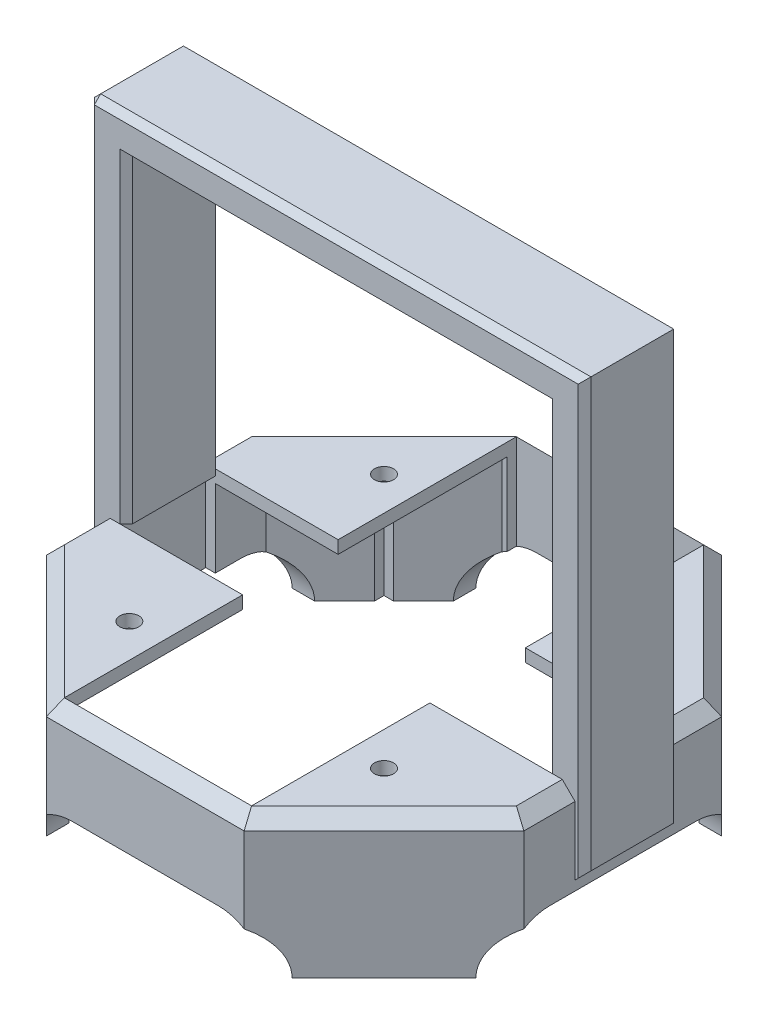
from build123d import *

# Parameters (mm, degrees)
BOSS_EXTRUDE1_DEPTH            = 50
BOSS_EXTRUDE4_DEPTH            = 55
CUT_EXTRUDE1_REACH             = 103.972
CUT_EXTRUDE2_REACH             = 103.972
CUT_EXTRUDE2_DIRECTION_2_REACH = 103.972
CHAMFER5_SIZE                  = 3
SKETCH11_R                     = 10
CUT_EXTRUDE5_DEPTH             = 78
CHAMFER7_SIZE                  = 2
BOSS_EXTRUDE10_DEPTH           = 50
BOSS_EXTRUDE10_DEPTH_BACK      = 14.2
SKETCH18_W                     = 6
SKETCH18_H                     = 15
BOSS_EXTRUDE10_2_DEPTH         = 50
BOSS_EXTRUDE10_2_DEPTH_BACK    = 14.2
SKETCH20_W                     = 78
SKETCH20_H                     = 15
BOSS_EXTRUDE11_DEPTH           = 6
CHAMFER8_SIZE                  = 3
CHAMFER9_SIZE                  = 1
CUT_EXTRUDE6_START             = -78
SKETCH21_W                     = 35
SKETCH21_H                     = 20
CUT_EXTRUDE6_DEPTH             = 78
CUT_EXTRUDE7_REACH             = 139.263
SKETCH22_W                     = 32.308657866
SKETCH22_H                     = 14
SKETCH25_R                     = 1.5
BOSS_EXTRUDE12_DEPTH           = 5
SKETCH26_W                     = 29.409162928
SKETCH26_H                     = 71
CUT_EXTRUDE9_DEPTH             = 15
SKETCH27_W                     = 71
SKETCH27_H                     = 15
CUT_EXTRUDE10_DEPTH            = 15
CHAMFER10_SIZE                 = 8
SKETCH28_W                     = 10.5
SKETCH28_H                     = 59
CUT_EXTRUDE11_DEPTH            = 2
SKETCH29_R                     = 3
CUT_EXTRUDE12_DEPTH            = 1
SKETCH30_W                     = 99
SKETCH30_H                     = 78
CUT_EXTRUDE13_DEPTH            = 83
CUT_EXTRUDE14_REACH            = 79.867
SKETCH31_R                     = 1.5
SKETCH32_W                     = 51
SKETCH32_H                     = 51
CUT_EXTRUDE15_DEPTH            = 20
CUT_EXTRUDE16_DEPTH            = 20


with BuildPart() as part:
    # Sketch1 → Boss-Extrude1 (new body)
    with BuildSketch(Plane(origin=(0, 0, 0), x_dir=(1, 0, 0), z_dir=(0, 1, 0))):
        Polygon((15.533008589, 37.5), (-15.533008589, 37.5), (-37.5, 15.533008589), (-37.5, -15.533008589), (-15.533008589, -37.5), (15.533008589, -37.5), (37.5, -15.533008589), (37.5, 15.533008589), align=None)
    extrude(amount=BOSS_EXTRUDE1_DEPTH)

    # Sketch7 → Boss-Extrude4 (add)
    with BuildSketch(Plane.XZ):
        Polygon((39, 16.154328933), (16.154328933, 39), (-16.154328933, 39), (-39, 16.154328933), (-39, -16.154328933), (-16.154328933, -39), (16.154328933, -39), (39, -16.154328933), align=None)
    extrude(amount=BOSS_EXTRUDE4_DEPTH)

    # Cut-Extrude1: up to this face of the body (flat: up to its plane)
    cut_extrude1_end = Plane(part.part.faces().sort_by_distance((0, 25, -37.5))[0])
    # Sketch3 → Cut-Extrude1 (cut, up to the picked face)
    with BuildSketch(Plane.XY.offset(37.5), mode=Mode.PRIVATE) as cut_extrude1_sk1:
        with BuildLine():
            Line((-11.5, 35.8), (11.5, 35.8))
            ThreePointArc((11.5, 35.8), (19.3, 28), (11.5, 20.2))
            Line((11.5, 20.2), (-11.5, 20.2))
            ThreePointArc((-11.5, 20.2), (-19.3, 28), (-11.5, 35.8))
        make_face()
    cut_extrude1_tool1 = split(extrude(cut_extrude1_sk1.sketch, amount=-CUT_EXTRUDE1_REACH, mode=Mode.PRIVATE), bisect_by=cut_extrude1_end, keep=Keep.BOTH, mode=Mode.PRIVATE)
    add(cut_extrude1_tool1.solids().sort_by(Axis((0, 28, 37.5), (0, 0, -1)))[0], mode=Mode.SUBTRACT)

    # Cut-Extrude2: up to this face of the body (flat: up to its plane)
    cut_extrude2_end = Plane(part.part.faces().sort_by_distance((39, -27.5, 0))[0])
    # Sketch4 → Cut-Extrude2 (cut, up to the picked face)
    with BuildSketch(Plane.ZY.offset(37.5), mode=Mode.PRIVATE) as cut_extrude2_sk1:
        with BuildLine():
            Line((-11.5, 35.8), (11.5, 35.8))
            ThreePointArc((11.5, 35.8), (19.3, 28), (11.5, 20.2))
            Line((11.5, 20.2), (-11.5, 20.2))
            ThreePointArc((-11.5, 20.2), (-19.3, 28), (-11.5, 35.8))
        make_face()
    cut_extrude2_tool1 = split(extrude(cut_extrude2_sk1.sketch, amount=-CUT_EXTRUDE2_REACH, mode=Mode.PRIVATE), bisect_by=cut_extrude2_end, keep=Keep.BOTH, mode=Mode.PRIVATE)
    add(cut_extrude2_tool1.solids().sort_by(Axis((-37.5, 28, 0), (1, 0, 0)))[0], mode=Mode.SUBTRACT)

    # Cut-Extrude2 direction 2: up to this face of the body (flat: up to its plane)
    cut_extrude2_direction_2_end = Plane(part.part.faces().sort_by_distance((-39, -27.5, 0))[0])
    # Sketch4 → Cut-Extrude2 direction 2 (cut, up to the picked face)
    with BuildSketch(Plane.ZY.offset(37.5), mode=Mode.PRIVATE) as cut_extrude2_direction_2_sk1:
        with BuildLine():
            Line((-11.5, 35.8), (11.5, 35.8))
            ThreePointArc((11.5, 35.8), (19.3, 28), (11.5, 20.2))
            Line((11.5, 20.2), (-11.5, 20.2))
            ThreePointArc((-11.5, 20.2), (-19.3, 28), (-11.5, 35.8))
        make_face()
    cut_extrude2_direction_2_tool1 = split(extrude(cut_extrude2_direction_2_sk1.sketch, amount=CUT_EXTRUDE2_DIRECTION_2_REACH, mode=Mode.PRIVATE), bisect_by=cut_extrude2_direction_2_end, keep=Keep.BOTH, mode=Mode.PRIVATE)
    add(cut_extrude2_direction_2_tool1.solids().sort_by(Axis((-37.5, 28, 0), (-1, 0, 0)))[0], mode=Mode.SUBTRACT)

    # Chamfer5
    # the kernel refuses this chamfer: 3 mm, written as the material it takes off along each edge
    with BuildSketch(Plane(origin=(-39, 0, 23.869377896), x_dir=(0.9996219169112968, 0.02749587661058636, 0), z_dir=(0, 0, -1))) as chamfer5_piece_1_section:
        Polygon((CHAMFER5_SIZE * 0.999621916911, CHAMFER5_SIZE * 0.0274958766106), (-CHAMFER5_SIZE * 0.0274958766106, CHAMFER5_SIZE * 0.999621916911), (0, 0), align=None)
    chamfer5_piece_1 = extrude(amount=47.738755793, mode=Mode.PRIVATE)
    chamfer5_piece_1 = split(chamfer5_piece_1, bisect_by=Plane(origin=(-35.021082904, -0.446756955, 18.011925685), z_dir=(-0.7071067811865472, 0, 0.7071067811865478)), keep=Keep.TOP, mode=Mode.PRIVATE)
    chamfer5_piece_1 = split(chamfer5_piece_1, bisect_by=Plane(origin=(-37.5, -0.446756955, 19.964409756), z_dir=(1, 0, 0)), keep=Keep.TOP, mode=Mode.PRIVATE)
    add(chamfer5_piece_1, mode=Mode.SUBTRACT)
    with BuildSketch(Plane(origin=(-39, 0, 23.869377896), x_dir=(0.9996219169112968, 0.02749587661058636, 0), z_dir=(0, 0, -1))) as chamfer5_piece_2_section:
        Polygon((CHAMFER5_SIZE * 0.999621916911, CHAMFER5_SIZE * 0.0274958766106), (-CHAMFER5_SIZE * 0.0274958766106, CHAMFER5_SIZE * 0.999621916911), (0, 0), align=None)
    chamfer5_piece_2 = extrude(amount=47.738755793, mode=Mode.PRIVATE)
    chamfer5_piece_2 = split(chamfer5_piece_2, bisect_by=Plane(origin=(-36.088598383, -1.192457028, 16.944410206), z_dir=(-0.7071067811865472, 0, 0.7071067811865478)), keep=Keep.TOP, mode=Mode.PRIVATE)
    chamfer5_piece_2 = split(chamfer5_piece_2, bisect_by=Plane(origin=(-37.5, -1.192457028, 19.252732769), z_dir=(-1, 0, 0)), keep=Keep.TOP, mode=Mode.PRIVATE)
    add(chamfer5_piece_2, mode=Mode.SUBTRACT)
    with BuildSketch(Plane(origin=(-39, 0, 23.869377896), x_dir=(0.9996219169112968, 0.02749587661058636, 0), z_dir=(0, 0, -1))) as chamfer5_piece_3_section:
        Polygon((CHAMFER5_SIZE * 0.999621916911, CHAMFER5_SIZE * 0.0274958766106), (-CHAMFER5_SIZE * 0.0274958766106, CHAMFER5_SIZE * 0.999621916911), (0, 0), align=None)
    chamfer5_piece_3 = extrude(amount=47.738755793, mode=Mode.PRIVATE)
    chamfer5_piece_3 = split(chamfer5_piece_3, bisect_by=Plane(origin=(-45.697358096, -1.172502344, 7.335650493), z_dir=(0.7071067811865472, 0, -0.7071067811865478)), keep=Keep.TOP, mode=Mode.PRIVATE)
    chamfer5_piece_3 = split(chamfer5_piece_3, bisect_by=Plane(origin=(-37.5, -1.172502344, 0), z_dir=(-1, 0, 0)), keep=Keep.TOP, mode=Mode.PRIVATE)
    chamfer5_piece_3 = split(chamfer5_piece_3, bisect_by=Plane(origin=(-45.697358096, -1.172502344, -7.335650493), z_dir=(0.7071067811865479, 0, 0.7071067811865472)), keep=Keep.TOP, mode=Mode.PRIVATE)
    add(chamfer5_piece_3, mode=Mode.SUBTRACT)
    with BuildSketch(Plane(origin=(-39, 0, 23.869377896), x_dir=(0.9996219169112968, 0.02749587661058636, 0), z_dir=(0, 0, -1))) as chamfer5_piece_4_section:
        Polygon((CHAMFER5_SIZE * 0.999621916911, CHAMFER5_SIZE * 0.0274958766106), (-CHAMFER5_SIZE * 0.0274958766106, CHAMFER5_SIZE * 0.999621916911), (0, 0), align=None)
    chamfer5_piece_4 = extrude(amount=47.738755793, mode=Mode.PRIVATE)
    chamfer5_piece_4 = split(chamfer5_piece_4, bisect_by=Plane(origin=(-37.5, -0.446756955, -19.964409756), z_dir=(1, 0, 0)), keep=Keep.TOP, mode=Mode.PRIVATE)
    chamfer5_piece_4 = split(chamfer5_piece_4, bisect_by=Plane(origin=(-35.021082904, -0.446756955, -18.011925685), z_dir=(-0.7071067811865479, 0, -0.7071067811865472)), keep=Keep.TOP, mode=Mode.PRIVATE)
    add(chamfer5_piece_4, mode=Mode.SUBTRACT)
    with BuildSketch(Plane(origin=(-39, 0, 23.869377896), x_dir=(0.9996219169112968, 0.02749587661058636, 0), z_dir=(0, 0, -1))) as chamfer5_piece_5_section:
        Polygon((CHAMFER5_SIZE * 0.999621916911, CHAMFER5_SIZE * 0.0274958766106), (-CHAMFER5_SIZE * 0.0274958766106, CHAMFER5_SIZE * 0.999621916911), (0, 0), align=None)
    chamfer5_piece_5 = extrude(amount=47.738755793, mode=Mode.PRIVATE)
    chamfer5_piece_5 = split(chamfer5_piece_5, bisect_by=Plane(origin=(-37.5, -1.192457028, -19.252732769), z_dir=(-1, 0, 0)), keep=Keep.TOP, mode=Mode.PRIVATE)
    chamfer5_piece_5 = split(chamfer5_piece_5, bisect_by=Plane(origin=(-36.088598383, -1.192457028, -16.944410206), z_dir=(-0.7071067811865479, 0, -0.7071067811865472)), keep=Keep.TOP, mode=Mode.PRIVATE)
    add(chamfer5_piece_5, mode=Mode.SUBTRACT)
    with BuildSketch(Plane(origin=(-44.45536344, 0, -10.698965493), x_dir=(0.7068394360706735, 0.027495876610586327, 0.7068394360706735), z_dir=(0.7071067811865476, 0, -0.7071067811865476))) as chamfer5_piece_6_section:
        Polygon((CHAMFER5_SIZE * 0.999621916911, CHAMFER5_SIZE * 0.0274958766106), (-CHAMFER5_SIZE * 0.0274958766106, CHAMFER5_SIZE * 0.999621916911), (0, 0), align=None)
    chamfer5_piece_6 = extrude(amount=47.738755793, mode=Mode.PRIVATE)
    chamfer5_piece_6 = split(chamfer5_piece_6, bisect_by=Plane(origin=(-37.5, -0.446756955, -12.027290412), z_dir=(-1, 0, 0)), keep=Keep.TOP, mode=Mode.PRIVATE)
    chamfer5_piece_6 = split(chamfer5_piece_6, bisect_by=Plane(origin=(-40.633473815, -0.446756955, -12.399534774), z_dir=(0.7071067811865479, 0, 0.7071067811865472)), keep=Keep.TOP, mode=Mode.PRIVATE)
    add(chamfer5_piece_6, mode=Mode.SUBTRACT)
    with BuildSketch(Plane(origin=(-44.45536344, 0, -10.698965493), x_dir=(0.7068394360706735, 0.027495876610586327, 0.7068394360706735), z_dir=(0.7071067811865476, 0, -0.7071067811865476))) as chamfer5_piece_7_section:
        Polygon((CHAMFER5_SIZE * 0.999621916911, CHAMFER5_SIZE * 0.0274958766106), (-CHAMFER5_SIZE * 0.0274958766106, CHAMFER5_SIZE * 0.999621916911), (0, 0), align=None)
    chamfer5_piece_7 = extrude(amount=47.738755793, mode=Mode.PRIVATE)
    chamfer5_piece_7 = split(chamfer5_piece_7, bisect_by=Plane(origin=(-37.5, -1.192457028, -13.53698528), z_dir=(-1, 0, 0)), keep=Keep.TOP, mode=Mode.PRIVATE)
    chamfer5_piece_7 = split(chamfer5_piece_7, bisect_by=Plane(origin=(-40.130242192, -1.192457028, -12.902766397), z_dir=(-0.7071067811865479, 0, -0.7071067811865472)), keep=Keep.TOP, mode=Mode.PRIVATE)
    add(chamfer5_piece_7, mode=Mode.SUBTRACT)
    with BuildSketch(Plane(origin=(-44.45536344, 0, -10.698965493), x_dir=(0.7068394360706735, 0.027495876610586327, 0.7068394360706735), z_dir=(0.7071067811865476, 0, -0.7071067811865476))) as chamfer5_piece_8_section:
        Polygon((CHAMFER5_SIZE * 0.999621916911, CHAMFER5_SIZE * 0.0274958766106), (-CHAMFER5_SIZE * 0.0274958766106, CHAMFER5_SIZE * 0.999621916911), (0, 0), align=None)
    chamfer5_piece_8 = extrude(amount=47.738755793, mode=Mode.PRIVATE)
    chamfer5_piece_8 = split(chamfer5_piece_8, bisect_by=Plane(origin=(-37.5, -1.172502344, -27.125823584), z_dir=(1, 0, 0)), keep=Keep.TOP, mode=Mode.PRIVATE)
    chamfer5_piece_8 = split(chamfer5_piece_8, bisect_by=Plane(origin=(-26.516504294, -1.172502344, -26.516504294), z_dir=(-0.7071067811865479, 0, -0.7071067811865472)), keep=Keep.TOP, mode=Mode.PRIVATE)
    chamfer5_piece_8 = split(chamfer5_piece_8, bisect_by=Plane(origin=(-27.125823584, -1.172502344, -37.5), z_dir=(0, 0, 1)), keep=Keep.TOP, mode=Mode.PRIVATE)
    add(chamfer5_piece_8, mode=Mode.SUBTRACT)
    with BuildSketch(Plane(origin=(-44.45536344, 0, -10.698965493), x_dir=(0.7068394360706735, 0.027495876610586327, 0.7068394360706735), z_dir=(0.7071067811865476, 0, -0.7071067811865476))) as chamfer5_piece_9_section:
        Polygon((CHAMFER5_SIZE * 0.999621916911, CHAMFER5_SIZE * 0.0274958766106), (-CHAMFER5_SIZE * 0.0274958766106, CHAMFER5_SIZE * 0.999621916911), (0, 0), align=None)
    chamfer5_piece_9 = extrude(amount=47.738755793, mode=Mode.PRIVATE)
    chamfer5_piece_9 = split(chamfer5_piece_9, bisect_by=Plane(origin=(-12.399534774, -0.446756955, -40.633473815), z_dir=(0.7071067811865479, 0, 0.7071067811865472)), keep=Keep.TOP, mode=Mode.PRIVATE)
    chamfer5_piece_9 = split(chamfer5_piece_9, bisect_by=Plane(origin=(-12.027290412, -0.446756955, -37.5), z_dir=(0, 0, -1)), keep=Keep.TOP, mode=Mode.PRIVATE)
    add(chamfer5_piece_9, mode=Mode.SUBTRACT)
    with BuildSketch(Plane(origin=(-44.45536344, 0, -10.698965493), x_dir=(0.7068394360706735, 0.027495876610586327, 0.7068394360706735), z_dir=(0.7071067811865476, 0, -0.7071067811865476))) as chamfer5_piece_10_section:
        Polygon((CHAMFER5_SIZE * 0.999621916911, CHAMFER5_SIZE * 0.0274958766106), (-CHAMFER5_SIZE * 0.0274958766106, CHAMFER5_SIZE * 0.999621916911), (0, 0), align=None)
    chamfer5_piece_10 = extrude(amount=47.738755793, mode=Mode.PRIVATE)
    chamfer5_piece_10 = split(chamfer5_piece_10, bisect_by=Plane(origin=(-12.902766397, -1.192457028, -40.130242192), z_dir=(-0.7071067811865479, 0, -0.7071067811865472)), keep=Keep.TOP, mode=Mode.PRIVATE)
    chamfer5_piece_10 = split(chamfer5_piece_10, bisect_by=Plane(origin=(-13.53698528, -1.192457028, -37.5), z_dir=(0, 0, -1)), keep=Keep.TOP, mode=Mode.PRIVATE)
    add(chamfer5_piece_10, mode=Mode.SUBTRACT)
    with BuildSketch(Plane(origin=(-23.869377896, 0, -39), x_dir=(0, 0.02749587661058636, 0.9996219169112968), z_dir=(1, 0, 0))) as chamfer5_piece_11_section:
        Polygon((CHAMFER5_SIZE * 0.999621916911, CHAMFER5_SIZE * 0.0274958766106), (-CHAMFER5_SIZE * 0.0274958766106, CHAMFER5_SIZE * 0.999621916911), (0, 0), align=None)
    chamfer5_piece_11 = extrude(amount=47.738755793, mode=Mode.PRIVATE)
    chamfer5_piece_11 = split(chamfer5_piece_11, bisect_by=Plane(origin=(-18.011925685, -0.446756955, -35.021082904), z_dir=(-0.7071067811865479, 0, -0.7071067811865472)), keep=Keep.TOP, mode=Mode.PRIVATE)
    chamfer5_piece_11 = split(chamfer5_piece_11, bisect_by=Plane(origin=(-19.964409756, -0.446756955, -37.5), z_dir=(0, 0, 1)), keep=Keep.TOP, mode=Mode.PRIVATE)
    add(chamfer5_piece_11, mode=Mode.SUBTRACT)
    with BuildSketch(Plane(origin=(-23.869377896, 0, -39), x_dir=(0, 0.02749587661058636, 0.9996219169112968), z_dir=(1, 0, 0))) as chamfer5_piece_12_section:
        Polygon((CHAMFER5_SIZE * 0.999621916911, CHAMFER5_SIZE * 0.0274958766106), (-CHAMFER5_SIZE * 0.0274958766106, CHAMFER5_SIZE * 0.999621916911), (0, 0), align=None)
    chamfer5_piece_12 = extrude(amount=47.738755793, mode=Mode.PRIVATE)
    chamfer5_piece_12 = split(chamfer5_piece_12, bisect_by=Plane(origin=(-16.944410206, -1.192457028, -36.088598383), z_dir=(-0.7071067811865479, 0, -0.7071067811865472)), keep=Keep.TOP, mode=Mode.PRIVATE)
    chamfer5_piece_12 = split(chamfer5_piece_12, bisect_by=Plane(origin=(-19.252732769, -1.192457028, -37.5), z_dir=(0, 0, -1)), keep=Keep.TOP, mode=Mode.PRIVATE)
    add(chamfer5_piece_12, mode=Mode.SUBTRACT)
    with BuildSketch(Plane(origin=(-23.869377896, 0, -39), x_dir=(0, 0.02749587661058636, 0.9996219169112968), z_dir=(1, 0, 0))) as chamfer5_piece_13_section:
        Polygon((CHAMFER5_SIZE * 0.999621916911, CHAMFER5_SIZE * 0.0274958766106), (-CHAMFER5_SIZE * 0.0274958766106, CHAMFER5_SIZE * 0.999621916911), (0, 0), align=None)
    chamfer5_piece_13 = extrude(amount=47.738755793, mode=Mode.PRIVATE)
    chamfer5_piece_13 = split(chamfer5_piece_13, bisect_by=Plane(origin=(7.335650493, -1.172502344, -45.697358096), z_dir=(-0.7071067811865474, 0, 0.7071067811865478)), keep=Keep.TOP, mode=Mode.PRIVATE)
    chamfer5_piece_13 = split(chamfer5_piece_13, bisect_by=Plane(origin=(-7.335650493, -1.172502344, -45.697358096), z_dir=(0.7071067811865479, 0, 0.7071067811865472)), keep=Keep.TOP, mode=Mode.PRIVATE)
    chamfer5_piece_13 = split(chamfer5_piece_13, bisect_by=Plane(origin=(0, -1.172502344, -37.5), z_dir=(0, 0, -1)), keep=Keep.TOP, mode=Mode.PRIVATE)
    add(chamfer5_piece_13, mode=Mode.SUBTRACT)
    with BuildSketch(Plane(origin=(-23.869377896, 0, -39), x_dir=(0, 0.02749587661058636, 0.9996219169112968), z_dir=(1, 0, 0))) as chamfer5_piece_14_section:
        Polygon((CHAMFER5_SIZE * 0.999621916911, CHAMFER5_SIZE * 0.0274958766106), (-CHAMFER5_SIZE * 0.0274958766106, CHAMFER5_SIZE * 0.999621916911), (0, 0), align=None)
    chamfer5_piece_14 = extrude(amount=47.738755793, mode=Mode.PRIVATE)
    chamfer5_piece_14 = split(chamfer5_piece_14, bisect_by=Plane(origin=(18.011925685, -0.446756955, -35.021082904), z_dir=(0.7071067811865474, 0, -0.7071067811865478)), keep=Keep.TOP, mode=Mode.PRIVATE)
    chamfer5_piece_14 = split(chamfer5_piece_14, bisect_by=Plane(origin=(19.964409756, -0.446756955, -37.5), z_dir=(0, 0, 1)), keep=Keep.TOP, mode=Mode.PRIVATE)
    add(chamfer5_piece_14, mode=Mode.SUBTRACT)
    with BuildSketch(Plane(origin=(-23.869377896, 0, -39), x_dir=(0, 0.02749587661058636, 0.9996219169112968), z_dir=(1, 0, 0))) as chamfer5_piece_15_section:
        Polygon((CHAMFER5_SIZE * 0.999621916911, CHAMFER5_SIZE * 0.0274958766106), (-CHAMFER5_SIZE * 0.0274958766106, CHAMFER5_SIZE * 0.999621916911), (0, 0), align=None)
    chamfer5_piece_15 = extrude(amount=47.738755793, mode=Mode.PRIVATE)
    chamfer5_piece_15 = split(chamfer5_piece_15, bisect_by=Plane(origin=(16.944410206, -1.192457028, -36.088598383), z_dir=(0.7071067811865474, 0, -0.7071067811865478)), keep=Keep.TOP, mode=Mode.PRIVATE)
    chamfer5_piece_15 = split(chamfer5_piece_15, bisect_by=Plane(origin=(19.252732769, -1.192457028, -37.5), z_dir=(0, 0, -1)), keep=Keep.TOP, mode=Mode.PRIVATE)
    add(chamfer5_piece_15, mode=Mode.SUBTRACT)
    with BuildSketch(Plane(origin=(10.698965493, 0, -44.45536344), x_dir=(-0.7068394360706736, 0.02749587661058638, 0.7068394360706733), z_dir=(0.7071067811865474, 0, 0.7071067811865478))) as chamfer5_piece_16_section:
        Polygon((CHAMFER5_SIZE * 0.999621916911, CHAMFER5_SIZE * 0.0274958766106), (-CHAMFER5_SIZE * 0.0274958766106, CHAMFER5_SIZE * 0.999621916911), (0, 0), align=None)
    chamfer5_piece_16 = extrude(amount=47.738755793, mode=Mode.PRIVATE)
    chamfer5_piece_16 = split(chamfer5_piece_16, bisect_by=Plane(origin=(12.399534774, -0.446756955, -40.633473815), z_dir=(-0.7071067811865474, 0, 0.7071067811865478)), keep=Keep.TOP, mode=Mode.PRIVATE)
    chamfer5_piece_16 = split(chamfer5_piece_16, bisect_by=Plane(origin=(12.027290412, -0.446756955, -37.5), z_dir=(0, 0, -1)), keep=Keep.TOP, mode=Mode.PRIVATE)
    add(chamfer5_piece_16, mode=Mode.SUBTRACT)
    with BuildSketch(Plane(origin=(10.698965493, 0, -44.45536344), x_dir=(-0.7068394360706736, 0.02749587661058638, 0.7068394360706733), z_dir=(0.7071067811865474, 0, 0.7071067811865478))) as chamfer5_piece_17_section:
        Polygon((CHAMFER5_SIZE * 0.999621916911, CHAMFER5_SIZE * 0.0274958766106), (-CHAMFER5_SIZE * 0.0274958766106, CHAMFER5_SIZE * 0.999621916911), (0, 0), align=None)
    chamfer5_piece_17 = extrude(amount=47.738755793, mode=Mode.PRIVATE)
    chamfer5_piece_17 = split(chamfer5_piece_17, bisect_by=Plane(origin=(12.902766397, -1.192457028, -40.130242192), z_dir=(0.7071067811865474, 0, -0.7071067811865478)), keep=Keep.TOP, mode=Mode.PRIVATE)
    chamfer5_piece_17 = split(chamfer5_piece_17, bisect_by=Plane(origin=(13.53698528, -1.192457028, -37.5), z_dir=(0, 0, -1)), keep=Keep.TOP, mode=Mode.PRIVATE)
    add(chamfer5_piece_17, mode=Mode.SUBTRACT)
    with BuildSketch(Plane(origin=(10.698965493, 0, -44.45536344), x_dir=(-0.7068394360706736, 0.02749587661058638, 0.7068394360706733), z_dir=(0.7071067811865474, 0, 0.7071067811865478))) as chamfer5_piece_18_section:
        Polygon((CHAMFER5_SIZE * 0.999621916911, CHAMFER5_SIZE * 0.0274958766106), (-CHAMFER5_SIZE * 0.0274958766106, CHAMFER5_SIZE * 0.999621916911), (0, 0), align=None)
    chamfer5_piece_18 = extrude(amount=47.738755793, mode=Mode.PRIVATE)
    chamfer5_piece_18 = split(chamfer5_piece_18, bisect_by=Plane(origin=(26.516504294, -1.172502344, -26.516504294), z_dir=(0.7071067811865474, 0, -0.7071067811865478)), keep=Keep.TOP, mode=Mode.PRIVATE)
    chamfer5_piece_18 = split(chamfer5_piece_18, bisect_by=Plane(origin=(37.5, -1.172502344, -27.125823584), z_dir=(-1, 0, 0)), keep=Keep.TOP, mode=Mode.PRIVATE)
    chamfer5_piece_18 = split(chamfer5_piece_18, bisect_by=Plane(origin=(27.125823584, -1.172502344, -37.5), z_dir=(0, 0, 1)), keep=Keep.TOP, mode=Mode.PRIVATE)
    add(chamfer5_piece_18, mode=Mode.SUBTRACT)
    with BuildSketch(Plane(origin=(10.698965493, 0, -44.45536344), x_dir=(-0.7068394360706736, 0.02749587661058638, 0.7068394360706733), z_dir=(0.7071067811865474, 0, 0.7071067811865478))) as chamfer5_piece_19_section:
        Polygon((CHAMFER5_SIZE * 0.999621916911, CHAMFER5_SIZE * 0.0274958766106), (-CHAMFER5_SIZE * 0.0274958766106, CHAMFER5_SIZE * 0.999621916911), (0, 0), align=None)
    chamfer5_piece_19 = extrude(amount=47.738755793, mode=Mode.PRIVATE)
    chamfer5_piece_19 = split(chamfer5_piece_19, bisect_by=Plane(origin=(40.633473815, -0.446756955, -12.399534774), z_dir=(-0.7071067811865474, 0, 0.7071067811865478)), keep=Keep.TOP, mode=Mode.PRIVATE)
    chamfer5_piece_19 = split(chamfer5_piece_19, bisect_by=Plane(origin=(37.5, -0.446756955, -12.027290412), z_dir=(1, 0, 0)), keep=Keep.TOP, mode=Mode.PRIVATE)
    add(chamfer5_piece_19, mode=Mode.SUBTRACT)
    with BuildSketch(Plane(origin=(10.698965493, 0, -44.45536344), x_dir=(-0.7068394360706736, 0.02749587661058638, 0.7068394360706733), z_dir=(0.7071067811865474, 0, 0.7071067811865478))) as chamfer5_piece_20_section:
        Polygon((CHAMFER5_SIZE * 0.999621916911, CHAMFER5_SIZE * 0.0274958766106), (-CHAMFER5_SIZE * 0.0274958766106, CHAMFER5_SIZE * 0.999621916911), (0, 0), align=None)
    chamfer5_piece_20 = extrude(amount=47.738755793, mode=Mode.PRIVATE)
    chamfer5_piece_20 = split(chamfer5_piece_20, bisect_by=Plane(origin=(40.130242192, -1.192457028, -12.902766397), z_dir=(0.7071067811865474, 0, -0.7071067811865478)), keep=Keep.TOP, mode=Mode.PRIVATE)
    chamfer5_piece_20 = split(chamfer5_piece_20, bisect_by=Plane(origin=(37.5, -1.192457028, -13.53698528), z_dir=(1, 0, 0)), keep=Keep.TOP, mode=Mode.PRIVATE)
    add(chamfer5_piece_20, mode=Mode.SUBTRACT)
    with BuildSketch(Plane(origin=(39, 0, -23.869377896), x_dir=(0.027495876610586778, -0.9996219169112968, 0), z_dir=(0, 0, 1))) as chamfer5_piece_21_section:
        Polygon((CHAMFER5_SIZE * 0.999621916911, -CHAMFER5_SIZE * 0.0274958766106), (-CHAMFER5_SIZE * 0.0274958766106, -CHAMFER5_SIZE * 0.999621916911), (0, 0), align=None)
    chamfer5_piece_21 = extrude(amount=47.738755793, mode=Mode.PRIVATE)
    chamfer5_piece_21 = split(chamfer5_piece_21, bisect_by=Plane(origin=(36.088598383, -1.192457028, -16.944410206), z_dir=(0.7071067811865474, 0, -0.7071067811865478)), keep=Keep.TOP, mode=Mode.PRIVATE)
    chamfer5_piece_21 = split(chamfer5_piece_21, bisect_by=Plane(origin=(37.5, -1.192457028, -19.252732769), z_dir=(1, 0, 0)), keep=Keep.TOP, mode=Mode.PRIVATE)
    add(chamfer5_piece_21, mode=Mode.SUBTRACT)
    with BuildSketch(Plane(origin=(39, 0, -23.869377896), x_dir=(0.027495876610586778, -0.9996219169112968, 0), z_dir=(0, 0, 1))) as chamfer5_piece_22_section:
        Polygon((CHAMFER5_SIZE * 0.999621916911, -CHAMFER5_SIZE * 0.0274958766106), (-CHAMFER5_SIZE * 0.0274958766106, -CHAMFER5_SIZE * 0.999621916911), (0, 0), align=None)
    chamfer5_piece_22 = extrude(amount=47.738755793, mode=Mode.PRIVATE)
    chamfer5_piece_22 = split(chamfer5_piece_22, bisect_by=Plane(origin=(35.021082904, -0.446756955, -18.011925685), z_dir=(0.7071067811865474, 0, -0.7071067811865478)), keep=Keep.TOP, mode=Mode.PRIVATE)
    chamfer5_piece_22 = split(chamfer5_piece_22, bisect_by=Plane(origin=(37.5, -0.446756955, -19.964409756), z_dir=(-1, 0, 0)), keep=Keep.TOP, mode=Mode.PRIVATE)
    add(chamfer5_piece_22, mode=Mode.SUBTRACT)
    with BuildSketch(Plane(origin=(39, 0, -23.869377896), x_dir=(0.027495876610586778, -0.9996219169112968, 0), z_dir=(0, 0, 1))) as chamfer5_piece_23_section:
        Polygon((CHAMFER5_SIZE * 0.999621916911, -CHAMFER5_SIZE * 0.0274958766106), (-CHAMFER5_SIZE * 0.0274958766106, -CHAMFER5_SIZE * 0.999621916911), (0, 0), align=None)
    chamfer5_piece_23 = extrude(amount=47.738755793, mode=Mode.PRIVATE)
    chamfer5_piece_23 = split(chamfer5_piece_23, bisect_by=Plane(origin=(45.697358096, -1.172502344, -7.335650493), z_dir=(-0.7071067811865474, 0, 0.7071067811865478)), keep=Keep.TOP, mode=Mode.PRIVATE)
    chamfer5_piece_23 = split(chamfer5_piece_23, bisect_by=Plane(origin=(37.5, -1.172502344, 0), z_dir=(1, 0, 0)), keep=Keep.TOP, mode=Mode.PRIVATE)
    chamfer5_piece_23 = split(chamfer5_piece_23, bisect_by=Plane(origin=(45.697358096, -1.172502344, 7.335650493), z_dir=(-0.7071067811865477, 0, -0.7071067811865475)), keep=Keep.TOP, mode=Mode.PRIVATE)
    add(chamfer5_piece_23, mode=Mode.SUBTRACT)
    with BuildSketch(Plane(origin=(39, 0, -23.869377896), x_dir=(0.027495876610586778, -0.9996219169112968, 0), z_dir=(0, 0, 1))) as chamfer5_piece_24_section:
        Polygon((CHAMFER5_SIZE * 0.999621916911, -CHAMFER5_SIZE * 0.0274958766106), (-CHAMFER5_SIZE * 0.0274958766106, -CHAMFER5_SIZE * 0.999621916911), (0, 0), align=None)
    chamfer5_piece_24 = extrude(amount=47.738755793, mode=Mode.PRIVATE)
    chamfer5_piece_24 = split(chamfer5_piece_24, bisect_by=Plane(origin=(37.5, -1.192457028, 19.252732769), z_dir=(1, 0, 0)), keep=Keep.TOP, mode=Mode.PRIVATE)
    chamfer5_piece_24 = split(chamfer5_piece_24, bisect_by=Plane(origin=(36.088598383, -1.192457028, 16.944410206), z_dir=(0.7071067811865477, 0, 0.7071067811865475)), keep=Keep.TOP, mode=Mode.PRIVATE)
    add(chamfer5_piece_24, mode=Mode.SUBTRACT)
    with BuildSketch(Plane(origin=(39, 0, -23.869377896), x_dir=(0.027495876610586778, -0.9996219169112968, 0), z_dir=(0, 0, 1))) as chamfer5_piece_25_section:
        Polygon((CHAMFER5_SIZE * 0.999621916911, -CHAMFER5_SIZE * 0.0274958766106), (-CHAMFER5_SIZE * 0.0274958766106, -CHAMFER5_SIZE * 0.999621916911), (0, 0), align=None)
    chamfer5_piece_25 = extrude(amount=47.738755793, mode=Mode.PRIVATE)
    chamfer5_piece_25 = split(chamfer5_piece_25, bisect_by=Plane(origin=(37.5, -0.446756955, 19.964409756), z_dir=(-1, 0, 0)), keep=Keep.TOP, mode=Mode.PRIVATE)
    chamfer5_piece_25 = split(chamfer5_piece_25, bisect_by=Plane(origin=(35.021082904, -0.446756955, 18.011925685), z_dir=(0.7071067811865477, 0, 0.7071067811865475)), keep=Keep.TOP, mode=Mode.PRIVATE)
    add(chamfer5_piece_25, mode=Mode.SUBTRACT)
    with BuildSketch(Plane(origin=(44.45536344, 0, 10.698965493), x_dir=(0.019442520806015228, -0.9996219169112968, 0.019442520806015235), z_dir=(-0.7071067811865477, 0, 0.7071067811865474))) as chamfer5_piece_26_section:
        Polygon((CHAMFER5_SIZE * 0.999621916911, -CHAMFER5_SIZE * 0.0274958766106), (-CHAMFER5_SIZE * 0.0274958766106, -CHAMFER5_SIZE * 0.999621916911), (0, 0), align=None)
    chamfer5_piece_26 = extrude(amount=47.738755793, mode=Mode.PRIVATE)
    chamfer5_piece_26 = split(chamfer5_piece_26, bisect_by=Plane(origin=(37.5, -1.192457028, 13.53698528), z_dir=(1, 0, 0)), keep=Keep.TOP, mode=Mode.PRIVATE)
    chamfer5_piece_26 = split(chamfer5_piece_26, bisect_by=Plane(origin=(40.130242192, -1.192457028, 12.902766397), z_dir=(0.7071067811865477, 0, 0.7071067811865475)), keep=Keep.TOP, mode=Mode.PRIVATE)
    add(chamfer5_piece_26, mode=Mode.SUBTRACT)
    with BuildSketch(Plane(origin=(44.45536344, 0, 10.698965493), x_dir=(0.019442520806015228, -0.9996219169112968, 0.019442520806015235), z_dir=(-0.7071067811865477, 0, 0.7071067811865474))) as chamfer5_piece_27_section:
        Polygon((CHAMFER5_SIZE * 0.999621916911, -CHAMFER5_SIZE * 0.0274958766106), (-CHAMFER5_SIZE * 0.0274958766106, -CHAMFER5_SIZE * 0.999621916911), (0, 0), align=None)
    chamfer5_piece_27 = extrude(amount=47.738755793, mode=Mode.PRIVATE)
    chamfer5_piece_27 = split(chamfer5_piece_27, bisect_by=Plane(origin=(37.5, -0.446756955, 12.027290412), z_dir=(1, 0, 0)), keep=Keep.TOP, mode=Mode.PRIVATE)
    chamfer5_piece_27 = split(chamfer5_piece_27, bisect_by=Plane(origin=(40.633473815, -0.446756955, 12.399534774), z_dir=(-0.7071067811865477, 0, -0.7071067811865475)), keep=Keep.TOP, mode=Mode.PRIVATE)
    add(chamfer5_piece_27, mode=Mode.SUBTRACT)
    with BuildSketch(Plane(origin=(44.45536344, 0, 10.698965493), x_dir=(0.019442520806015228, -0.9996219169112968, 0.019442520806015235), z_dir=(-0.7071067811865477, 0, 0.7071067811865474))) as chamfer5_piece_28_section:
        Polygon((CHAMFER5_SIZE * 0.999621916911, -CHAMFER5_SIZE * 0.0274958766106), (-CHAMFER5_SIZE * 0.0274958766106, -CHAMFER5_SIZE * 0.999621916911), (0, 0), align=None)
    chamfer5_piece_28 = extrude(amount=47.738755793, mode=Mode.PRIVATE)
    chamfer5_piece_28 = split(chamfer5_piece_28, bisect_by=Plane(origin=(37.5, -1.172502344, 27.125823584), z_dir=(-1, 0, 0)), keep=Keep.TOP, mode=Mode.PRIVATE)
    chamfer5_piece_28 = split(chamfer5_piece_28, bisect_by=Plane(origin=(26.516504294, -1.172502344, 26.516504294), z_dir=(0.7071067811865477, 0, 0.7071067811865475)), keep=Keep.TOP, mode=Mode.PRIVATE)
    chamfer5_piece_28 = split(chamfer5_piece_28, bisect_by=Plane(origin=(27.125823584, -1.172502344, 37.5), z_dir=(0, 0, -1)), keep=Keep.TOP, mode=Mode.PRIVATE)
    add(chamfer5_piece_28, mode=Mode.SUBTRACT)
    with BuildSketch(Plane(origin=(44.45536344, 0, 10.698965493), x_dir=(0.019442520806015228, -0.9996219169112968, 0.019442520806015235), z_dir=(-0.7071067811865477, 0, 0.7071067811865474))) as chamfer5_piece_29_section:
        Polygon((CHAMFER5_SIZE * 0.999621916911, -CHAMFER5_SIZE * 0.0274958766106), (-CHAMFER5_SIZE * 0.0274958766106, -CHAMFER5_SIZE * 0.999621916911), (0, 0), align=None)
    chamfer5_piece_29 = extrude(amount=47.738755793, mode=Mode.PRIVATE)
    chamfer5_piece_29 = split(chamfer5_piece_29, bisect_by=Plane(origin=(12.902766397, -1.192457028, 40.130242192), z_dir=(0.7071067811865477, 0, 0.7071067811865475)), keep=Keep.TOP, mode=Mode.PRIVATE)
    chamfer5_piece_29 = split(chamfer5_piece_29, bisect_by=Plane(origin=(13.53698528, -1.192457028, 37.5), z_dir=(0, 0, 1)), keep=Keep.TOP, mode=Mode.PRIVATE)
    add(chamfer5_piece_29, mode=Mode.SUBTRACT)
    with BuildSketch(Plane(origin=(44.45536344, 0, 10.698965493), x_dir=(0.019442520806015228, -0.9996219169112968, 0.019442520806015235), z_dir=(-0.7071067811865477, 0, 0.7071067811865474))) as chamfer5_piece_30_section:
        Polygon((CHAMFER5_SIZE * 0.999621916911, -CHAMFER5_SIZE * 0.0274958766106), (-CHAMFER5_SIZE * 0.0274958766106, -CHAMFER5_SIZE * 0.999621916911), (0, 0), align=None)
    chamfer5_piece_30 = extrude(amount=47.738755793, mode=Mode.PRIVATE)
    chamfer5_piece_30 = split(chamfer5_piece_30, bisect_by=Plane(origin=(12.399534774, -0.446756955, 40.633473815), z_dir=(-0.7071067811865477, 0, -0.7071067811865475)), keep=Keep.TOP, mode=Mode.PRIVATE)
    chamfer5_piece_30 = split(chamfer5_piece_30, bisect_by=Plane(origin=(12.027290412, -0.446756955, 37.5), z_dir=(0, 0, 1)), keep=Keep.TOP, mode=Mode.PRIVATE)
    add(chamfer5_piece_30, mode=Mode.SUBTRACT)
    with BuildSketch(Plane(origin=(23.869377896, 0, 39), x_dir=(0, -0.9996219169112968, 0.027495876610586778), z_dir=(-1, 0, 0))) as chamfer5_piece_31_section:
        Polygon((CHAMFER5_SIZE * 0.999621916911, -CHAMFER5_SIZE * 0.0274958766106), (-CHAMFER5_SIZE * 0.0274958766106, -CHAMFER5_SIZE * 0.999621916911), (0, 0), align=None)
    chamfer5_piece_31 = extrude(amount=47.738755793, mode=Mode.PRIVATE)
    chamfer5_piece_31 = split(chamfer5_piece_31, bisect_by=Plane(origin=(16.944410206, -1.192457028, 36.088598383), z_dir=(0.7071067811865477, 0, 0.7071067811865475)), keep=Keep.TOP, mode=Mode.PRIVATE)
    chamfer5_piece_31 = split(chamfer5_piece_31, bisect_by=Plane(origin=(19.252732769, -1.192457028, 37.5), z_dir=(0, 0, 1)), keep=Keep.TOP, mode=Mode.PRIVATE)
    add(chamfer5_piece_31, mode=Mode.SUBTRACT)
    with BuildSketch(Plane(origin=(23.869377896, 0, 39), x_dir=(0, -0.9996219169112968, 0.027495876610586778), z_dir=(-1, 0, 0))) as chamfer5_piece_32_section:
        Polygon((CHAMFER5_SIZE * 0.999621916911, -CHAMFER5_SIZE * 0.0274958766106), (-CHAMFER5_SIZE * 0.0274958766106, -CHAMFER5_SIZE * 0.999621916911), (0, 0), align=None)
    chamfer5_piece_32 = extrude(amount=47.738755793, mode=Mode.PRIVATE)
    chamfer5_piece_32 = split(chamfer5_piece_32, bisect_by=Plane(origin=(18.011925685, -0.446756955, 35.021082904), z_dir=(0.7071067811865477, 0, 0.7071067811865475)), keep=Keep.TOP, mode=Mode.PRIVATE)
    chamfer5_piece_32 = split(chamfer5_piece_32, bisect_by=Plane(origin=(19.964409756, -0.446756955, 37.5), z_dir=(0, 0, -1)), keep=Keep.TOP, mode=Mode.PRIVATE)
    add(chamfer5_piece_32, mode=Mode.SUBTRACT)
    with BuildSketch(Plane(origin=(23.869377896, 0, 39), x_dir=(0, -0.9996219169112968, 0.027495876610586778), z_dir=(-1, 0, 0))) as chamfer5_piece_33_section:
        Polygon((CHAMFER5_SIZE * 0.999621916911, -CHAMFER5_SIZE * 0.0274958766106), (-CHAMFER5_SIZE * 0.0274958766106, -CHAMFER5_SIZE * 0.999621916911), (0, 0), align=None)
    chamfer5_piece_33 = extrude(amount=47.738755793, mode=Mode.PRIVATE)
    chamfer5_piece_33 = split(chamfer5_piece_33, bisect_by=Plane(origin=(7.335650493, -1.172502344, 45.697358096), z_dir=(-0.7071067811865477, 0, -0.7071067811865475)), keep=Keep.TOP, mode=Mode.PRIVATE)
    chamfer5_piece_33 = split(chamfer5_piece_33, bisect_by=Plane(origin=(0, -1.172502344, 37.5), z_dir=(0, 0, 1)), keep=Keep.TOP, mode=Mode.PRIVATE)
    chamfer5_piece_33 = split(chamfer5_piece_33, bisect_by=Plane(origin=(-7.335650493, -1.172502344, 45.697358096), z_dir=(0.7071067811865472, 0, -0.7071067811865478)), keep=Keep.TOP, mode=Mode.PRIVATE)
    add(chamfer5_piece_33, mode=Mode.SUBTRACT)
    with BuildSketch(Plane(origin=(23.869377896, 0, 39), x_dir=(0, -0.9996219169112968, 0.027495876610586778), z_dir=(-1, 0, 0))) as chamfer5_piece_34_section:
        Polygon((CHAMFER5_SIZE * 0.999621916911, -CHAMFER5_SIZE * 0.0274958766106), (-CHAMFER5_SIZE * 0.0274958766106, -CHAMFER5_SIZE * 0.999621916911), (0, 0), align=None)
    chamfer5_piece_34 = extrude(amount=47.738755793, mode=Mode.PRIVATE)
    chamfer5_piece_34 = split(chamfer5_piece_34, bisect_by=Plane(origin=(-19.252732769, -1.192457028, 37.5), z_dir=(0, 0, 1)), keep=Keep.TOP, mode=Mode.PRIVATE)
    chamfer5_piece_34 = split(chamfer5_piece_34, bisect_by=Plane(origin=(-16.944410206, -1.192457028, 36.088598383), z_dir=(-0.7071067811865472, 0, 0.7071067811865478)), keep=Keep.TOP, mode=Mode.PRIVATE)
    add(chamfer5_piece_34, mode=Mode.SUBTRACT)
    with BuildSketch(Plane(origin=(23.869377896, 0, 39), x_dir=(0, -0.9996219169112968, 0.027495876610586778), z_dir=(-1, 0, 0))) as chamfer5_piece_35_section:
        Polygon((CHAMFER5_SIZE * 0.999621916911, -CHAMFER5_SIZE * 0.0274958766106), (-CHAMFER5_SIZE * 0.0274958766106, -CHAMFER5_SIZE * 0.999621916911), (0, 0), align=None)
    chamfer5_piece_35 = extrude(amount=47.738755793, mode=Mode.PRIVATE)
    chamfer5_piece_35 = split(chamfer5_piece_35, bisect_by=Plane(origin=(-19.964409756, -0.446756955, 37.5), z_dir=(0, 0, -1)), keep=Keep.TOP, mode=Mode.PRIVATE)
    chamfer5_piece_35 = split(chamfer5_piece_35, bisect_by=Plane(origin=(-18.011925685, -0.446756955, 35.021082904), z_dir=(-0.7071067811865472, 0, 0.7071067811865478)), keep=Keep.TOP, mode=Mode.PRIVATE)
    add(chamfer5_piece_35, mode=Mode.SUBTRACT)
    with BuildSketch(Plane(origin=(-10.698965493, 0, 44.45536344), x_dir=(0.7068394360706738, 0.02749587661058633, -0.7068394360706732), z_dir=(-0.7071067811865472, 0, -0.7071067811865478))) as chamfer5_piece_36_section:
        Polygon((CHAMFER5_SIZE * 0.999621916911, CHAMFER5_SIZE * 0.0274958766106), (-CHAMFER5_SIZE * 0.0274958766106, CHAMFER5_SIZE * 0.999621916911), (0, 0), align=None)
    chamfer5_piece_36 = extrude(amount=47.738755793, mode=Mode.PRIVATE)
    chamfer5_piece_36 = split(chamfer5_piece_36, bisect_by=Plane(origin=(-12.027290412, -0.446756955, 37.5), z_dir=(0, 0, 1)), keep=Keep.TOP, mode=Mode.PRIVATE)
    chamfer5_piece_36 = split(chamfer5_piece_36, bisect_by=Plane(origin=(-12.399534774, -0.446756955, 40.633473815), z_dir=(0.7071067811865472, 0, -0.7071067811865478)), keep=Keep.TOP, mode=Mode.PRIVATE)
    add(chamfer5_piece_36, mode=Mode.SUBTRACT)
    with BuildSketch(Plane(origin=(-10.698965493, 0, 44.45536344), x_dir=(0.7068394360706738, 0.02749587661058633, -0.7068394360706732), z_dir=(-0.7071067811865472, 0, -0.7071067811865478))) as chamfer5_piece_37_section:
        Polygon((CHAMFER5_SIZE * 0.999621916911, CHAMFER5_SIZE * 0.0274958766106), (-CHAMFER5_SIZE * 0.0274958766106, CHAMFER5_SIZE * 0.999621916911), (0, 0), align=None)
    chamfer5_piece_37 = extrude(amount=47.738755793, mode=Mode.PRIVATE)
    chamfer5_piece_37 = split(chamfer5_piece_37, bisect_by=Plane(origin=(-13.53698528, -1.192457028, 37.5), z_dir=(0, 0, 1)), keep=Keep.TOP, mode=Mode.PRIVATE)
    chamfer5_piece_37 = split(chamfer5_piece_37, bisect_by=Plane(origin=(-12.902766397, -1.192457028, 40.130242192), z_dir=(-0.7071067811865472, 0, 0.7071067811865478)), keep=Keep.TOP, mode=Mode.PRIVATE)
    add(chamfer5_piece_37, mode=Mode.SUBTRACT)
    with BuildSketch(Plane(origin=(-10.698965493, 0, 44.45536344), x_dir=(0.7068394360706738, 0.02749587661058633, -0.7068394360706732), z_dir=(-0.7071067811865472, 0, -0.7071067811865478))) as chamfer5_piece_38_section:
        Polygon((CHAMFER5_SIZE * 0.999621916911, CHAMFER5_SIZE * 0.0274958766106), (-CHAMFER5_SIZE * 0.0274958766106, CHAMFER5_SIZE * 0.999621916911), (0, 0), align=None)
    chamfer5_piece_38 = extrude(amount=47.738755793, mode=Mode.PRIVATE)
    chamfer5_piece_38 = split(chamfer5_piece_38, bisect_by=Plane(origin=(-27.125823584, -1.172502344, 37.5), z_dir=(0, 0, -1)), keep=Keep.TOP, mode=Mode.PRIVATE)
    chamfer5_piece_38 = split(chamfer5_piece_38, bisect_by=Plane(origin=(-26.516504294, -1.172502344, 26.516504294), z_dir=(-0.7071067811865472, 0, 0.7071067811865478)), keep=Keep.TOP, mode=Mode.PRIVATE)
    chamfer5_piece_38 = split(chamfer5_piece_38, bisect_by=Plane(origin=(-37.5, -1.172502344, 27.125823584), z_dir=(1, 0, 0)), keep=Keep.TOP, mode=Mode.PRIVATE)
    add(chamfer5_piece_38, mode=Mode.SUBTRACT)
    with BuildSketch(Plane(origin=(-10.698965493, 0, 44.45536344), x_dir=(0.7068394360706738, 0.02749587661058633, -0.7068394360706732), z_dir=(-0.7071067811865472, 0, -0.7071067811865478))) as chamfer5_piece_39_section:
        Polygon((CHAMFER5_SIZE * 0.999621916911, CHAMFER5_SIZE * 0.0274958766106), (-CHAMFER5_SIZE * 0.0274958766106, CHAMFER5_SIZE * 0.999621916911), (0, 0), align=None)
    chamfer5_piece_39 = extrude(amount=47.738755793, mode=Mode.PRIVATE)
    chamfer5_piece_39 = split(chamfer5_piece_39, bisect_by=Plane(origin=(-40.633473815, -0.446756955, 12.399534774), z_dir=(0.7071067811865472, 0, -0.7071067811865478)), keep=Keep.TOP, mode=Mode.PRIVATE)
    chamfer5_piece_39 = split(chamfer5_piece_39, bisect_by=Plane(origin=(-37.5, -0.446756955, 12.027290412), z_dir=(-1, 0, 0)), keep=Keep.TOP, mode=Mode.PRIVATE)
    add(chamfer5_piece_39, mode=Mode.SUBTRACT)
    with BuildSketch(Plane(origin=(-10.698965493, 0, 44.45536344), x_dir=(0.7068394360706738, 0.02749587661058633, -0.7068394360706732), z_dir=(-0.7071067811865472, 0, -0.7071067811865478))) as chamfer5_piece_40_section:
        Polygon((CHAMFER5_SIZE * 0.999621916911, CHAMFER5_SIZE * 0.0274958766106), (-CHAMFER5_SIZE * 0.0274958766106, CHAMFER5_SIZE * 0.999621916911), (0, 0), align=None)
    chamfer5_piece_40 = extrude(amount=47.738755793, mode=Mode.PRIVATE)
    chamfer5_piece_40 = split(chamfer5_piece_40, bisect_by=Plane(origin=(-40.130242192, -1.192457028, 12.902766397), z_dir=(-0.7071067811865472, 0, 0.7071067811865478)), keep=Keep.TOP, mode=Mode.PRIVATE)
    chamfer5_piece_40 = split(chamfer5_piece_40, bisect_by=Plane(origin=(-37.5, -1.192457028, 13.53698528), z_dir=(-1, 0, 0)), keep=Keep.TOP, mode=Mode.PRIVATE)
    add(chamfer5_piece_40, mode=Mode.SUBTRACT)

    # Sketch11 → Cut-Extrude5 (cut)
    with BuildSketch(Plane.XY.offset(-39)):
        with Locations(Location((0, -17, 0), (0, 0, 180))):
            Circle(SKETCH11_R)
    extrude(amount=CUT_EXTRUDE5_DEPTH, mode=Mode.SUBTRACT)

    # Chamfer7
    chamfer7_edges = [part.edges().sort_by_distance(p)[0] for p in [
        (-26.516504294, 50, -26.516504294),
        (-37.5, 50, 0),
        (-26.516504294, 50, 26.516504294),
        (0, 50, 37.5),
        (26.516504294, 50, 26.516504294),
        (37.5, 50, 0),
        (26.516504294, 50, -26.516504294),
        (0, 50, -37.5),
    ]]
    chamfer(chamfer7_edges, length=CHAMFER7_SIZE)

    # Sketch21 → Cut-Extrude6 (cut)
    with BuildSketch(Plane.XY.offset(39).offset(CUT_EXTRUDE6_START)):
        with Locations((0, -45)):
            Rectangle(SKETCH21_W, SKETCH21_H)
    extrude(amount=CUT_EXTRUDE6_DEPTH, mode=Mode.SUBTRACT)

    # Cut-Extrude7: up to this face of the body (flat: up to its plane)
    cut_extrude7_end = Plane(part.part.faces().sort_by_distance((39, -29, 0))[0])
    # Sketch22 → Cut-Extrude7 (cut, up to the picked face)
    with BuildSketch(Plane.ZY.offset(39), mode=Mode.PRIVATE) as cut_extrude7_sk1:
        with Locations((0, -48)):
            Rectangle(SKETCH22_W, SKETCH22_H)
    cut_extrude7_tool1 = split(extrude(cut_extrude7_sk1.sketch, amount=-CUT_EXTRUDE7_REACH, mode=Mode.PRIVATE), bisect_by=cut_extrude7_end, keep=Keep.BOTH, mode=Mode.PRIVATE)
    add(cut_extrude7_tool1.solids().sort_by(Axis((-39, -48, 0), (1, 0, 0)))[0], mode=Mode.SUBTRACT)

    # Sketch25 → Boss-Extrude12 (add)
    # profile 1 of 4: a face of its own
    with BuildSketch(Plane.XZ.offset(55)):
        Polygon((-39, -16.154328933), (-49.5, -16.154328933), (-49.5, -29.5), (-25.654328933, -29.5), align=None)
        with Locations(Location((-42.5, -22.5, 0), (0, 0, 270))):
            Circle(SKETCH25_R, mode=Mode.SUBTRACT)
    # profile 2 of 4: a face of its own
    with BuildSketch(Plane.XZ.offset(55)):
        Polygon((-39, 16.154328933), (-49.5, 16.154328933), (-49.5, 29.5), (-25.654328933, 29.5), align=None)
        with Locations(Location((-42.5, 22.5, 0), (0, 0, 270))):
            Circle(SKETCH25_R, mode=Mode.SUBTRACT)
    # profile 3 of 4: a face of its own
    with BuildSketch(Plane.XZ.offset(55)):
        Polygon((39, -16.154328933), (49.5, -16.154328933), (49.5, -29.5), (25.654328933, -29.5), align=None)
        with Locations(Location((42.5, -22.5, 0), (0, 0, 270))):
            Circle(SKETCH25_R, mode=Mode.SUBTRACT)
    # profile 4 of 4: a face of its own
    with BuildSketch(Plane.XZ.offset(55)):
        Polygon((39, 16.154328933), (25.654328933, 29.5), (49.5, 29.5), (49.5, 16.154328933), align=None)
        with Locations(Location((42.5, 22.5, 0), (0, 0, 270))):
            Circle(SKETCH25_R, mode=Mode.SUBTRACT)
    extrude(amount=-BOSS_EXTRUDE12_DEPTH)

    # Sketch26 → Cut-Extrude9 (cut)
    with BuildSketch(Plane(origin=(0, 50, 0), x_dir=(1, 0, 0), z_dir=(0, 1, 0))):
        Rectangle(SKETCH26_W, SKETCH26_H)
    extrude(amount=-CUT_EXTRUDE9_DEPTH, mode=Mode.SUBTRACT)


with BuildPart() as body_2:
    # Sketch18 → Boss-Extrude10 (new, two sides: drawn at the far end of the back side and taken through both)
    with BuildSketch(Plane(origin=(0, 50, 0), x_dir=(1, 0, 0), z_dir=(0, 1, 0)).offset(-BOSS_EXTRUDE10_DEPTH_BACK)):
        with Locations((-36, 0)):
            Rectangle(SKETCH18_W, SKETCH18_H)
    extrude(amount=BOSS_EXTRUDE10_DEPTH + BOSS_EXTRUDE10_DEPTH_BACK)



with BuildPart() as body_3:
    # Sketch18 → Boss-Extrude10 2 (new, two sides: drawn at the far end of the back side and taken through both)
    with BuildSketch(Plane(origin=(0, 50, 0), x_dir=(1, 0, 0), z_dir=(0, 1, 0)).offset(-BOSS_EXTRUDE10_2_DEPTH_BACK)):
        with Locations((36, 0)):
            Rectangle(SKETCH18_W, SKETCH18_H)
    extrude(amount=BOSS_EXTRUDE10_2_DEPTH + BOSS_EXTRUDE10_2_DEPTH_BACK)


with BuildPart() as body_2_1:
    add(body_2.part)

    add(body_3.part)  # Boss-Extrude11 merges body 3
    # Sketch20 → Boss-Extrude11 (add)
    with BuildSketch(Plane(origin=(0, 100, 0), x_dir=(1, 0, 0), z_dir=(0, 1, 0))):
        Rectangle(SKETCH20_W, SKETCH20_H)
    extrude(amount=BOSS_EXTRUDE11_DEPTH)

    # Chamfer8
    chamfer8_edges = [body_2_1.edges().sort_by_distance(p)[0] for p in [
        (39, 35.8, 0),
        (-39, 35.8, 0),
    ]]
    chamfer(chamfer8_edges, length=CHAMFER8_SIZE)

    # Chamfer9
    chamfer9_edges = [body_2_1.edges().sort_by_distance(p)[0] for p in [
        (0, 100, 7.5),
        (39, 72.4, 7.5),
        (39, 72.4, -7.5),
        (-39, 106, 0),
        (0, 106, 7.5),
        (0, 106, -7.5),
        (0, 100, -7.5),
        (33, 67.9, -7.5),
        (33, 67.9, 7.5),
        (-39, 72.4, -7.5),
        (-39, 72.4, 7.5),
        (-33, 67.9, -7.5),
        (-33, 67.9, 7.5),
    ]]
    chamfer(chamfer9_edges, length=CHAMFER9_SIZE)


with BuildPart() as cut_extrude10_tool:
    # Sketch27 → Cut-Extrude10 (new body)
    with BuildSketch(Plane(origin=(0, 50, 0), x_dir=(1, 0, 0), z_dir=(0, 1, 0))):
        Rectangle(SKETCH27_W, SKETCH27_H)
    extrude(amount=-CUT_EXTRUDE10_DEPTH)


with BuildPart() as part_1:
    add(part.part)

    # Cut-Extrude10: cut by cut_extrude10_tool
    add(cut_extrude10_tool.part, mode=Mode.SUBTRACT)

    # Chamfer10
    chamfer10_edges = [part_1.edges().sort_by_distance(p)[0] for p in [
        (-49.5, -52.5, -29.5),
        (-49.5, -52.5, 29.5),
        (49.5, -52.5, -29.5),
        (49.5, -52.5, 29.5),
    ]]
    chamfer(chamfer10_edges, length=CHAMFER10_SIZE)

    # Sketch28 → Cut-Extrude11 (cut)
    with BuildSketch(Plane.XZ.offset(55)):
        with Locations((44.25, 0)):
            Rectangle(SKETCH28_W, SKETCH28_H)
        with Locations((-44.25, 0)):
            Rectangle(SKETCH28_W, SKETCH28_H)
    extrude(amount=-CUT_EXTRUDE11_DEPTH, mode=Mode.SUBTRACT)

    # Sketch29 → Cut-Extrude12 (cut)
    with BuildSketch(Plane(origin=(0, -50, 0), x_dir=(1, 0, 0), z_dir=(0, 1, 0))):
        with Locations(Location((-42.5, 22.5, 0), (0, 0, 270))):
            Circle(SKETCH29_R)
        with Locations(Location((42.5, 22.5, 0), (0, 0, 270))):
            Circle(SKETCH29_R)
        with Locations(Location((42.5, -22.5, 0), (0, 0, 270))):
            Circle(SKETCH29_R)
        with Locations(Location((-42.5, -22.5, 0), (0, 0, 270))):
            Circle(SKETCH29_R)
    extrude(amount=-CUT_EXTRUDE12_DEPTH, mode=Mode.SUBTRACT)

    # Sketch30 → Cut-Extrude13 (cut)
    with BuildSketch(Plane.XZ.offset(55)):
        Rectangle(SKETCH30_W, SKETCH30_H)
    extrude(amount=-CUT_EXTRUDE13_DEPTH, mode=Mode.SUBTRACT)

    # Cut-Extrude14: up to this face of the body (flat: up to its plane)
    cut_extrude14_end = Plane(part_1.part.faces().sort_by_distance((-24.111002863, 28, -24.111002863))[0])
    # Sketch31 → Cut-Extrude14 (cut, up to the picked face)
    with BuildSketch(Plane(origin=(0, 50, 0), x_dir=(1, 0, 0), z_dir=(0, 1, 0)), mode=Mode.PRIVATE) as cut_extrude14_sk1:
        with Locations(Location((-20, 20, 0), (0, 0, 270))):
            Circle(SKETCH31_R)
    cut_extrude14_tool1 = split(extrude(cut_extrude14_sk1.sketch, amount=-CUT_EXTRUDE14_REACH, mode=Mode.PRIVATE), bisect_by=cut_extrude14_end, keep=Keep.BOTH, mode=Mode.PRIVATE)
    # Sketch31 → Cut-Extrude14 (cut, up to the picked face)
    with BuildSketch(Plane(origin=(0, 50, 0), x_dir=(1, 0, 0), z_dir=(0, 1, 0)), mode=Mode.PRIVATE) as cut_extrude14_sk2:
        with Locations(Location((20, 20, 0), (0, 0, 270))):
            Circle(SKETCH31_R)
    cut_extrude14_tool2 = split(extrude(cut_extrude14_sk2.sketch, amount=-CUT_EXTRUDE14_REACH, mode=Mode.PRIVATE), bisect_by=cut_extrude14_end, keep=Keep.BOTH, mode=Mode.PRIVATE)
    # Sketch31 → Cut-Extrude14 (cut, up to the picked face)
    with BuildSketch(Plane(origin=(0, 50, 0), x_dir=(1, 0, 0), z_dir=(0, 1, 0)), mode=Mode.PRIVATE) as cut_extrude14_sk3:
        with Locations(Location((20, -20, 0), (0, 0, 270))):
            Circle(SKETCH31_R)
    cut_extrude14_tool3 = split(extrude(cut_extrude14_sk3.sketch, amount=-CUT_EXTRUDE14_REACH, mode=Mode.PRIVATE), bisect_by=cut_extrude14_end, keep=Keep.BOTH, mode=Mode.PRIVATE)
    # Sketch31 → Cut-Extrude14 (cut, up to the picked face)
    with BuildSketch(Plane(origin=(0, 50, 0), x_dir=(1, 0, 0), z_dir=(0, 1, 0)), mode=Mode.PRIVATE) as cut_extrude14_sk4:
        with Locations(Location((-20, -20, 0), (0, 0, 270))):
            Circle(SKETCH31_R)
    cut_extrude14_tool4 = split(extrude(cut_extrude14_sk4.sketch, amount=-CUT_EXTRUDE14_REACH, mode=Mode.PRIVATE), bisect_by=cut_extrude14_end, keep=Keep.BOTH, mode=Mode.PRIVATE)
    add(cut_extrude14_tool1.solids().sort_by(Axis((-20, 50, -20), (0, -1, 0)))[0], mode=Mode.SUBTRACT)
    add(cut_extrude14_tool2.solids().sort_by(Axis((20, 50, -20), (0, -1, 0)))[0], mode=Mode.SUBTRACT)
    add(cut_extrude14_tool3.solids().sort_by(Axis((20, 50, 20), (0, -1, 0)))[0], mode=Mode.SUBTRACT)
    add(cut_extrude14_tool4.solids().sort_by(Axis((-20, 50, 20), (0, -1, 0)))[0], mode=Mode.SUBTRACT)

    # Sketch32 → Cut-Extrude15 (cut)
    with BuildSketch(Plane.XZ.offset(-28)):
        Rectangle(SKETCH32_W, SKETCH32_H)
    extrude(amount=-CUT_EXTRUDE15_DEPTH, mode=Mode.SUBTRACT)

    # Sketch34 → Cut-Extrude16 (cut)
    with BuildSketch(Plane.XZ.offset(-28)):
        Polygon((-34, 15.497474683), (-15.497474683, 34), (15.497474683, 34), (34, 15.497474683), (34, -15.497474683), (15.497474683, -34), (-15.497474683, -34), (-34, -15.497474683), align=None)
    extrude(amount=-CUT_EXTRUDE16_DEPTH, mode=Mode.SUBTRACT)


with BuildPart() as body_2_2:
    add(body_2_1.part)

    # Cut-Extrude10: cut by cut_extrude10_tool
    add(cut_extrude10_tool.part, mode=Mode.SUBTRACT)


solid = Compound([part_1.part, body_2_2.part])
